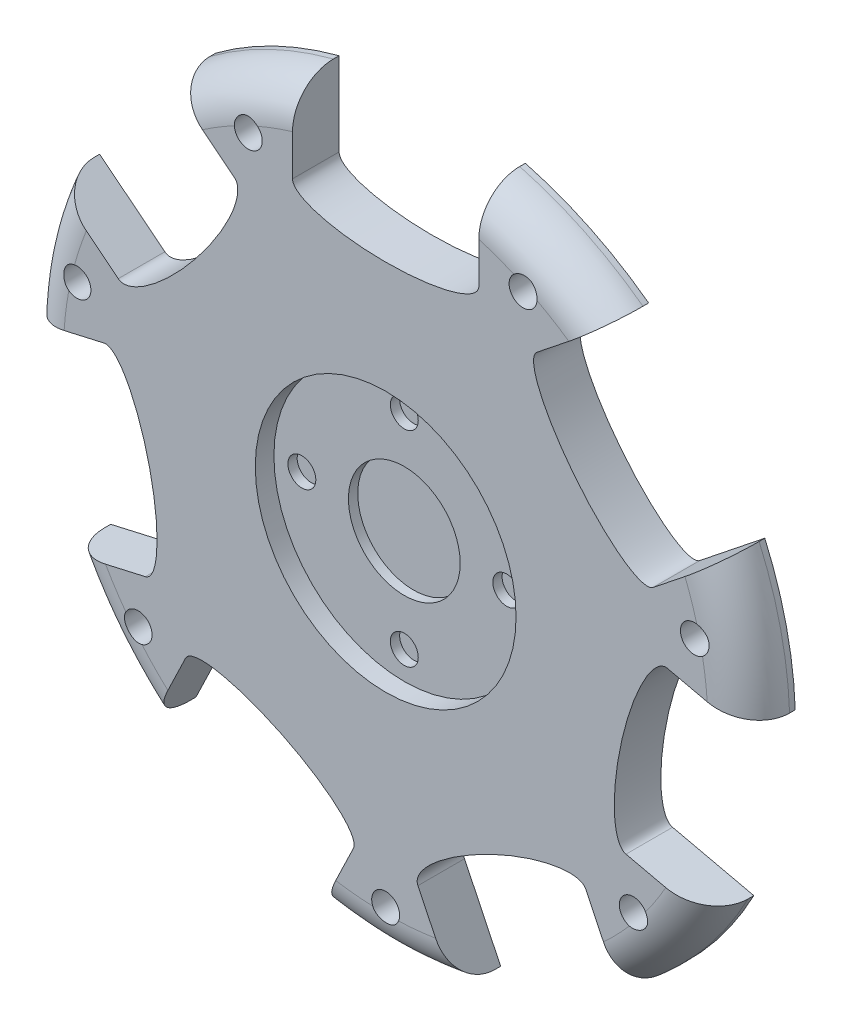
from build123d import *

# Parameters (mm, degrees)
EXTRUDE_2_DEPTH     = 5
SKETCH_3_R          = 1.5
SKETCH_3_R_2        = 6
CUT_EXTRUDE_2_DEPTH = 3
SKETCH_4_R          = 14
CUT_EXTRUDE_3_DEPTH = 2
SCALE_1_SCALE       = 0.683
FILLET_2_R          = 3


with BuildPart() as part:
    # 草图1 → 凸台-拉伸2 (new body)
    with BuildSketch(Plane.XY):
        with BuildLine():
            Line((-10, 28.75), (-10, 37.69615365))
            ThreePointArc((-10, 37.69615365), (-16.921465826, 35.137785848), (-23.237141673, 31.321482195))
            Line((-23.237141673, 31.321482195), (-16.242757102, 25.743646628))
            add(Edge.make_bspline(
                [(-28.71255314, 10.107016979), (-26.562516563, 8.392420024), (-20.327618544, 16.210734848), (-14.092720526, 24.029049673), (-16.242757102, 25.743646628)],
                knots=[3.141592654, 3.141592654, 3.141592654, 4.71238898, 4.71238898, 6.283185307, 6.283185307, 6.283185307], degree=2, weights=[1, 0.707106781, 1, 0.707106781, 1]))
            Line((-28.71255314, 10.107016979), (-35.70693771, 15.684852545))
            ThreePointArc((-35.70693771, 15.684852545), (-38.022188575, 8.678316424), (-38.976241715, 1.361095805))
            Line((-38.976241715, 1.361095805), (-30.254386815, 3.351802271))
            add(Edge.make_bspline(
                [(-25.803968136, -16.146755973), (-23.122916377, -15.534823405), (-25.348125717, -5.785544283), (-27.573335056, 3.963734839), (-30.254386815, 3.351802271)],
                knots=[3.141592654, 3.141592654, 3.141592654, 4.71238898, 4.71238898, 6.283185307, 6.283185307, 6.283185307], degree=2, weights=[1, 0.707106781, 1, 0.707106781, 1]))
            Line((-25.803968136, -16.146755973), (-34.525823036, -18.137462439))
            ThreePointArc((-34.525823036, -18.137462439), (-30.491427816, -24.316102272), (-25.365436775, -29.624223487))
            Line((-25.365436775, -29.624223487), (-21.483846179, -21.564017561))
            add(Edge.make_bspline(
                [(-3.464468821, -30.241692343), (-2.271287836, -27.764028085), (-11.280977135, -23.425190395), (-20.290666434, -19.086352706), (-21.483846179, -21.564017561)],
                knots=[3.141592585, 3.141592585, 3.141592585, 4.71238898, 4.71238898, 6.283185376, 6.283185376, 6.283185376], degree=2, weights=[1, 0.707106757, 1, 0.707106757, 1]))
            Line((-3.464468821, -30.241692343), (-7.346059417, -38.301898269))
            ThreePointArc((-7.346059417, -38.301898269), (0, -39), (7.346059417, -38.301898269))
            Line((7.346059417, -38.301898269), (3.464468821, -30.241692343))
            add(Edge.make_bspline(
                [(21.483846179, -21.564017561), (20.290666435, -19.086352704), (11.280977135, -23.425190394), (2.271287834, -27.764028085), (3.464468821, -30.241692343)],
                knots=[3.141592585, 3.141592585, 3.141592585, 4.71238898, 4.71238898, 6.283185376, 6.283185376, 6.283185376], degree=2, weights=[1, 0.707106757, 1, 0.707106757, 1]))
            Line((21.483846179, -21.564017561), (25.365436775, -29.624223487))
            ThreePointArc((25.365436775, -29.624223487), (30.491427816, -24.316102272), (34.525823036, -18.137462439))
            Line((34.525823036, -18.137462439), (25.803968136, -16.146755973))
            add(Edge.make_bspline(
                [(30.254386815, 3.351802271), (27.573335056, 3.963734839), (25.348125717, -5.785544283), (23.122916377, -15.534823405), (25.803968136, -16.146755973)],
                knots=[3.141592654, 3.141592654, 3.141592654, 4.71238898, 4.71238898, 6.283185307, 6.283185307, 6.283185307], degree=2, weights=[1, 0.707106781, 1, 0.707106781, 1]))
            Line((30.254386815, 3.351802271), (38.976241715, 1.361095805))
            ThreePointArc((38.976241715, 1.361095805), (38.022188575, 8.678316424), (35.70693771, 15.684852545))
            Line((35.70693771, 15.684852545), (28.71255314, 10.107016979))
            add(Edge.make_bspline(
                [(16.242757102, 25.743646628), (14.092720526, 24.029049673), (20.327618544, 16.210734848), (26.562516563, 8.392420024), (28.71255314, 10.107016979)],
                knots=[3.141592654, 3.141592654, 3.141592654, 4.71238898, 4.71238898, 6.283185307, 6.283185307, 6.283185307], degree=2, weights=[1, 0.707106781, 1, 0.707106781, 1]))
            Line((16.242757102, 25.743646628), (23.237141673, 31.321482195))
            ThreePointArc((23.237141673, 31.321482195), (16.921465826, 35.137785848), (10, 37.69615365))
            Line((10, 37.69615365), (10, 28.75))
            add(Edge.make_bspline(
                [(-10, 28.75), (-10, 26), (0, 26), (10, 26), (10, 28.75)],
                knots=[3.141592654, 3.141592654, 3.141592654, 4.71238898, 4.71238898, 6.283185307, 6.283185307, 6.283185307], degree=2, weights=[1, 0.707106781, 1, 0.707106781, 1]))
        make_face()
    extrude(amount=EXTRUDE_2_DEPTH)

    # 草图3 → 切除-拉伸2 (cut)
    with BuildSketch(Plane.XY.offset(5)):
        with Locations((0, 11)):
            Circle(SKETCH_3_R)
        with Locations((11, 0)):
            Circle(SKETCH_3_R)
        with Locations((0, -11)):
            Circle(SKETCH_3_R)
        with Locations((-11, 0)):
            Circle(SKETCH_3_R)
        Circle(SKETCH_3_R_2)
        with Locations((14.75204713, 30.632941509)):
            Circle(SKETCH_3_R)
        with Locations((33.147549014, 7.565711755)):
            Circle(SKETCH_3_R)
        with Locations((26.582270404, -21.198653263)):
            Circle(SKETCH_3_R)
        with Locations((0, -34)):
            Circle(SKETCH_3_R)
        with Locations((-26.582270404, -21.198653263)):
            Circle(SKETCH_3_R)
        with Locations((-33.147549014, 7.565711755)):
            Circle(SKETCH_3_R)
        with Locations((-14.75204713, 30.632941509)):
            Circle(SKETCH_3_R)
    extrude(amount=-CUT_EXTRUDE_2_DEPTH, mode=Mode.SUBTRACT)

    # 草图4 → 切除-拉伸3 (cut)
    with BuildSketch(Plane.XY.offset(5)):
        Circle(SKETCH_4_R)
    extrude(amount=-CUT_EXTRUDE_3_DEPTH, mode=Mode.SUBTRACT)


with BuildPart() as part_1:
    # 缩放比例1: scaled about (6.0631e-05, 6.5e-08, 2.357409877)
    add(part.part.scale(SCALE_1_SCALE).moved(Location((1.922e-05, 2.1e-08, 0.747298931))))

    # 圆角2
    # the kernel refuses this fillet: 3 mm, written as the material it takes off along each edge
    with BuildSketch(Plane(origin=(1.922e-05, 2.1e-08, 4.162298931), x_dir=(0.022261525981924914, 0.9997521815234794, 0), z_dir=(0.9997521815234794, -0.022261525981924914, 0))) as fillet_2_piece_1:
        with BuildLine():
            CenterArc((26.637 - FILLET_2_R, -FILLET_2_R), FILLET_2_R, 0, 90)
            Line((26.637, -FILLET_2_R), (26.637, 0))
            Line((26.637, 0), (26.637 - FILLET_2_R, 0))
        make_face()
    revolve(axis=Axis((1.922e-05, 2.1e-08, 4.162298931), (0, 0, 1)), revolution_arc=53.979765145, mode=Mode.SUBTRACT)
    with BuildSketch(Plane(origin=(1.922e-05, 2.1e-08, 4.162298931), x_dir=(-0.7677578957576012, 0.6407400514263646, 0), z_dir=(0.6407400514263646, 0.7677578957576012, 0))) as fillet_2_piece_2:
        with BuildLine():
            CenterArc((26.637 - FILLET_2_R, -FILLET_2_R), FILLET_2_R, 0, 90)
            Line((26.637, -FILLET_2_R), (26.637, 0))
            Line((26.637, 0), (26.637 - FILLET_2_R, 0))
        make_face()
    revolve(axis=Axis((1.922e-05, 2.1e-08, 4.162298931), (0, 0, 1)), revolution_arc=53.979765145, mode=Mode.SUBTRACT)
    with BuildSketch(Plane(origin=(1.922e-05, 2.1e-08, 4.162298931), x_dir=(-0.9796399625847012, -0.20076240610992194, 0), z_dir=(-0.20076240610992194, 0.9796399625847012, 0))) as fillet_2_piece_3:
        with BuildLine():
            CenterArc((26.637 - FILLET_2_R, -FILLET_2_R), FILLET_2_R, 0, 90)
            Line((26.637, -FILLET_2_R), (26.637, 0))
            Line((26.637, 0), (26.637 - FILLET_2_R, 0))
        make_face()
    revolve(axis=Axis((1.922e-05, 2.1e-08, 4.162298931), (0, 0, 1)), revolution_arc=53.979765145, mode=Mode.SUBTRACT)
    with BuildSketch(Plane(origin=(1.922e-05, 2.1e-08, 4.162298931), x_dir=(-0.4538331565720623, -0.8910866770386806, 0), z_dir=(-0.8910866770386806, 0.4538331565720623, 0))) as fillet_2_piece_4:
        with BuildLine():
            CenterArc((26.637 - FILLET_2_R, -FILLET_2_R), FILLET_2_R, 0, 90)
            Line((26.637, -FILLET_2_R), (26.637, 0))
            Line((26.637, 0), (26.637 - FILLET_2_R, 0))
        make_face()
    revolve(axis=Axis((1.922e-05, 2.1e-08, 4.162298931), (0, 0, 1)), revolution_arc=53.979765145, mode=Mode.SUBTRACT)
    with BuildSketch(Plane(origin=(1.922e-05, 2.1e-08, 4.162298931), x_dir=(0.4137192728486232, -0.9104045053016854, 0), z_dir=(-0.9104045053016854, -0.4137192728486232, 0))) as fillet_2_piece_5:
        with BuildLine():
            CenterArc((26.637 - FILLET_2_R, -FILLET_2_R), FILLET_2_R, 0, 90)
            Line((26.637, -FILLET_2_R), (26.637, 0))
            Line((26.637, 0), (26.637 - FILLET_2_R, 0))
        make_face()
    revolve(axis=Axis((1.922e-05, 2.1e-08, 4.162298931), (0, 0, 1)), revolution_arc=53.979765145, mode=Mode.SUBTRACT)
    with BuildSketch(Plane(origin=(1.922e-05, 2.1e-08, 4.162298931), x_dir=(0.9697326514791175, -0.24416917220501125, 0), z_dir=(-0.24416917220501125, -0.9697326514791175, 0))) as fillet_2_piece_6:
        with BuildLine():
            CenterArc((26.637 - FILLET_2_R, -FILLET_2_R), FILLET_2_R, 0, 90)
            Line((26.637, -FILLET_2_R), (26.637, 0))
            Line((26.637, 0), (26.637 - FILLET_2_R, 0))
        make_face()
    revolve(axis=Axis((1.922e-05, 2.1e-08, 4.162298931), (0, 0, 1)), revolution_arc=53.979765145, mode=Mode.SUBTRACT)
    with BuildSketch(Plane(origin=(1.922e-05, 2.1e-08, 4.162298931), x_dir=(0.7955175646046951, 0.6059305277054577, 0), z_dir=(0.6059305277054577, -0.7955175646046951, 0))) as fillet_2_piece_7:
        with BuildLine():
            CenterArc((26.637 - FILLET_2_R, -FILLET_2_R), FILLET_2_R, 0, 90)
            Line((26.637 - FILLET_2_R, 0), (26.637, 0))
            Line((26.637, 0), (26.637, -FILLET_2_R))
        make_face()
    revolve(axis=Axis((1.922e-05, 2.1e-08, 4.162298931), (0, 0, 1)), revolution_arc=53.979765145, mode=Mode.SUBTRACT)


solid = part_1.part
